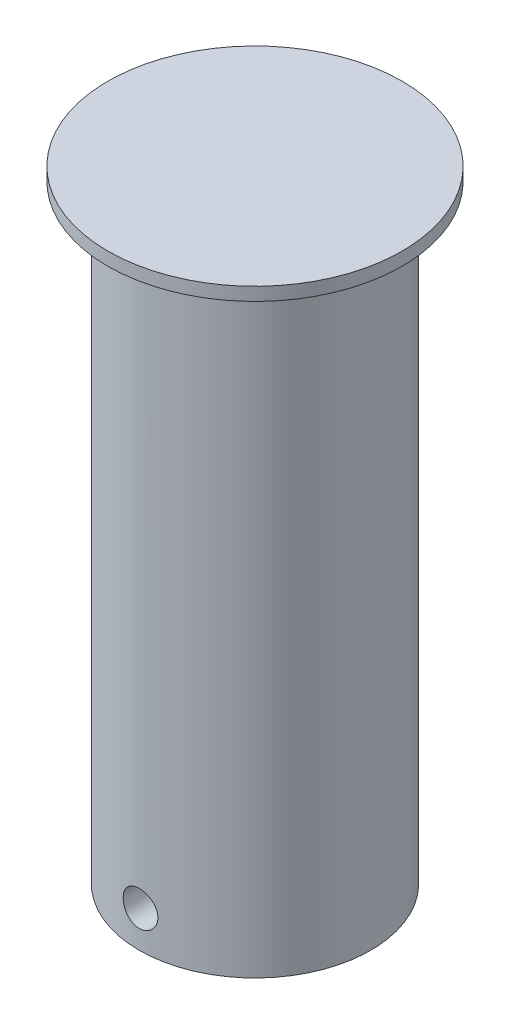
from build123d import *

# Parameters (mm, degrees)
SKETCH1_R               = 15
BOSS_EXTRUDE1_DEPTH     = 27
BOSS_EXTRUDE2_START     = 1.7
SKETCH2_R               = 15
BOSS_EXTRUDE2_DEPTH     = 1.7
CUT_EXTRUDE1_DEPTH      = 23.4
SKETCH5_R               = 15
BOSS_EXTRUDE3_DEPTH     = 51.8
CUT_EXTRUDE3_DEPTH      = 82.605391979
CUT_EXTRUDE3_DEPTH_BACK = 82.605391979
SKETCH6_R               = 2.2479
SKETCH10_R              = 19.07
BOSS_EXTRUDE4_DEPTH     = 1.7


with BuildPart() as part:
    # Sketch1 → Boss-Extrude1 (new body)
    with BuildSketch(Plane(origin=(0, 0, 0), x_dir=(1, 0, 0), z_dir=(0, 1, 0))):
        Circle(SKETCH1_R)
    extrude(amount=BOSS_EXTRUDE1_DEPTH)

    # Sketch2 → Boss-Extrude2 (add)
    with BuildSketch(Plane.XZ.offset(BOSS_EXTRUDE2_START)):
        Circle(SKETCH2_R)
    extrude(amount=-BOSS_EXTRUDE2_DEPTH)

    # Sketch3 → Cut-Extrude1 (cut)
    with BuildSketch(Plane.XZ.offset(1.7)):
        Polygon((-2.800148806, 4.85), (-5.600297611, 0), (-2.800148806, -4.85), (2.800148806, -4.85), (5.600297611, 0), (2.800148806, 4.85), align=None)
    extrude(amount=-CUT_EXTRUDE1_DEPTH, mode=Mode.SUBTRACT)

    # Sketch5 → Boss-Extrude3 (add)
    with BuildSketch(Plane(origin=(0, 27, 0), x_dir=(1, 0, 0), z_dir=(0, 1, 0))):
        Circle(SKETCH5_R)
    extrude(amount=BOSS_EXTRUDE3_DEPTH)

    # Sketch6 → Cut-Extrude3 (cut, two sides: drawn at the far end of the back side and taken through both)
    with BuildSketch(Plane.XY.offset(-CUT_EXTRUDE3_DEPTH_BACK)):
        with Locations((0, 3)):
            Circle(SKETCH6_R)
    extrude(amount=CUT_EXTRUDE3_DEPTH + CUT_EXTRUDE3_DEPTH_BACK, mode=Mode.SUBTRACT)

    # Sketch10 → Boss-Extrude4 (add)
    with BuildSketch(Plane(origin=(0, 78.8, 0), x_dir=(1, 0, 0), z_dir=(0, 1, 0))):
        Circle(SKETCH10_R)
    extrude(amount=-BOSS_EXTRUDE4_DEPTH)


solid = part.part
